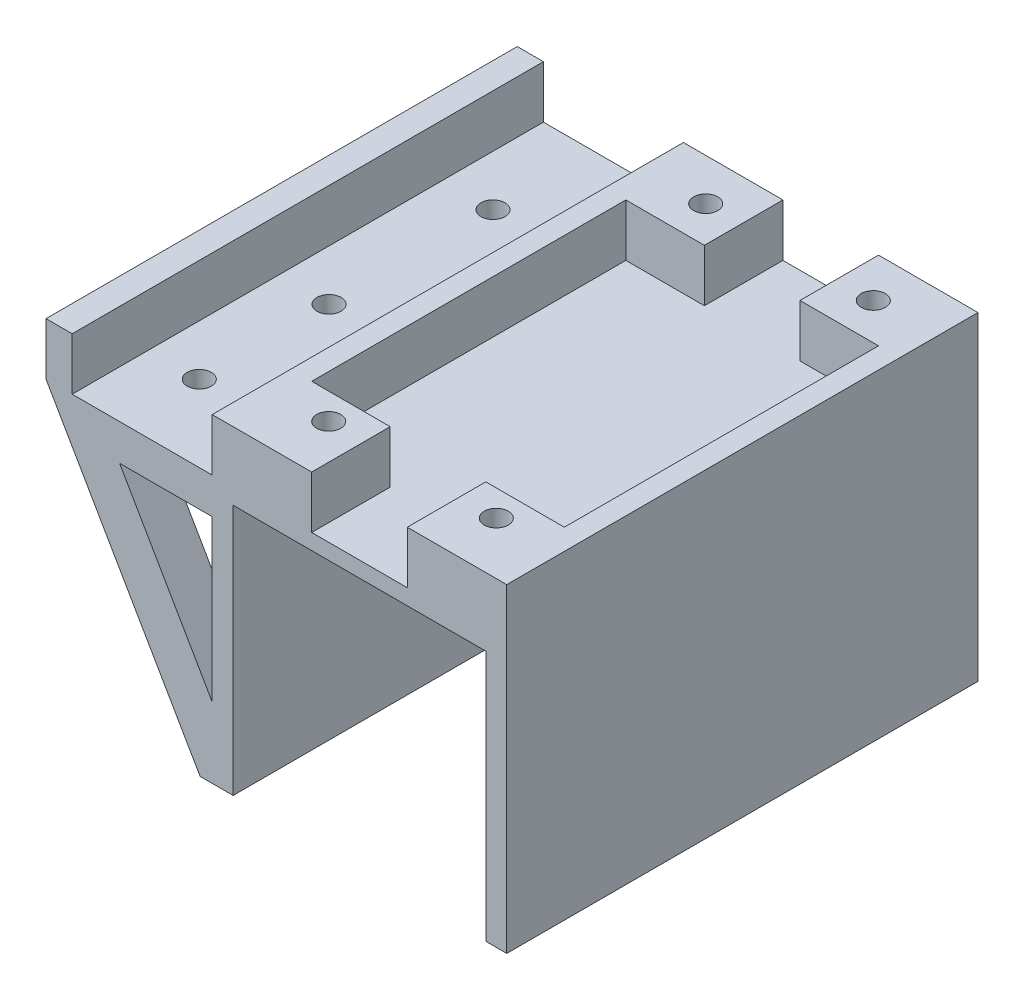
from build123d import *

# Parameters (mm, degrees)
SKETCH1_W            = 48.254
SKETCH1_H            = 10
BOSS_EXTRUDE1_DEPTH  = 70
BOSS_EXTRUDE3_DEPTH  = 8
BOSS_EXTRUDE4_DEPTH  = 8
BOSS_EXTRUDE5_DEPTH  = 8
BOSS_EXTRUDE6_DEPTH  = 70
SKETCH7_W            = 40.394634483
SKETCH7_H            = 17
CUT_EXTRUDE3_DEPTH   = 70
BOSS_EXTRUDE7_DEPTH  = 70
BOSS_EXTRUDE10_DEPTH = 8
BOSS_EXTRUDE11_DEPTH = 70
SKETCH13_W           = 83.001411072
SKETCH13_H           = 87.868559997
CUT_EXTRUDE4_DEPTH   = 4
SKETCH14_W           = 48.254
SKETCH14_H           = 10
BOSS_EXTRUDE12_DEPTH = 20
SKETCH16_W           = 56.254
SKETCH16_H           = 5
CUT_EXTRUDE5_DEPTH   = 100
SKETCH17_W           = 15
SKETCH17_H           = 15
BOSS_EXTRUDE14_DEPTH = 13
CUT_EXTRUDE8_DEPTH   = 5
SKETCH21_R           = 2.3
CUT_EXTRUDE9_DEPTH   = 15
SKETCH23_W           = 12
SKETCH23_H           = 40.530858039
CUT_EXTRUDE10_DEPTH  = 9
SKETCH25_R           = 2.3
CUT_EXTRUDE11_DEPTH  = 20
SKETCH26_R           = 2.3
CUT_EXTRUDE12_DEPTH  = 20
BOSS_EXTRUDE16_DEPTH = 20
SKETCH28_W           = 15
SKETCH28_H           = 15
BOSS_EXTRUDE17_DEPTH = 10
SKETCH29_R           = 2.3
CUT_EXTRUDE13_DEPTH  = 20
SKETCH30_W           = 10.391026801
SKETCH30_H           = 12
BOSS_EXTRUDE18_DEPTH = 5
SKETCH31_R           = 2.3
CUT_EXTRUDE14_DEPTH  = 45
SKETCH41_W           = 5
SKETCH41_H           = 90
BOSS_EXTRUDE19_DEPTH = 10


with BuildPart() as part:
    # Sketch1 → Boss-Extrude1 (new body)
    with BuildSketch(Plane.XY):
        Polygon((0, 70), (0, 0), (4, 0), (4, 52), (52.254, 52), (52.254, 0), (56.254, 0), (56.254, 70), align=None)
        with Locations((28.127, 60)):
            Rectangle(SKETCH1_W, SKETCH1_H, mode=Mode.SUBTRACT)
    extrude(amount=BOSS_EXTRUDE1_DEPTH)

    # Sketch3 → Boss-Extrude3 (add)
    with BuildSketch(Plane.XY.offset(70)):
        Polygon((0, 62.5), (0, 70), (-40.394634483, 70), (0, 0.034440722), (0, 17.466679003), (-26, 62.5), align=None)
    extrude(amount=-BOSS_EXTRUDE3_DEPTH)

    # Sketch4 → Boss-Extrude4 (add)
    with BuildSketch(Plane(origin=(0, 0, 0), x_dir=(-1, 0, 0), z_dir=(0, 0, -1))):
        Polygon((0, 70), (40.394634483, 70), (0, 0), (0, 17.466679003), (26, 62.5), (0, 62.5), align=None)
    extrude(amount=-BOSS_EXTRUDE4_DEPTH)

    # Sketch5 → Boss-Extrude5 (add)
    with BuildSketch(Plane(origin=(0, 0, 39), x_dir=(-1, 0, 0), z_dir=(0, 0, -1))):
        Polygon((0, 62.5), (0, 70), (40.394634483, 70), (0, 0), (0, 17.466679003), (26, 62.5), align=None)
    extrude(amount=BOSS_EXTRUDE5_DEPTH)

    # Sketch6 → Boss-Extrude6 (add)
    with BuildSketch(Plane(origin=(0, 0, 0), x_dir=(-1, 0, 0), z_dir=(0, 0, -1))):
        Polygon((0, 62.5), (36.066637932, 62.5), (40.394634483, 70), (0, 70), align=None)
        Polygon((-4, 0), (0, 0), (7.50186069, 13), (-4, 13), align=None)
    extrude(amount=-BOSS_EXTRUDE6_DEPTH)

    # Sketch7 → Cut-Extrude3 (cut)
    with BuildSketch(Plane.XY.offset(70)):
        with Locations((-20.197317242, 61.5)):
            Rectangle(SKETCH7_W, SKETCH7_H)
    extrude(amount=-CUT_EXTRUDE3_DEPTH, mode=Mode.SUBTRACT)

    # Sketch8 → Boss-Extrude7 (add)
    with BuildSketch(Plane(origin=(0, 0, 0), x_dir=(-1, 0, 0), z_dir=(0, 0, -1))):
        Polygon((-4, 55), (-4, 52), (30.007442759, 52), (31.73864138, 55), align=None)
    extrude(amount=-BOSS_EXTRUDE7_DEPTH)

    # Sketch11 → Boss-Extrude10 (add)
    with BuildSketch(Plane.XY.offset(70)):
        Polygon((-31.73864138, 55), (0, 0), (-3.053687451, 13), (-27.288965695, 55), align=None)
    extrude(amount=-BOSS_EXTRUDE10_DEPTH)

    # Sketch12 → Boss-Extrude11 (add)
    with BuildSketch(Plane.XY.offset(70)):
        Polygon((-31.73864138, 55), (-27.75981023, 48.105069917), (0, 48.105069917), (0, 55), align=None)
    extrude(amount=-BOSS_EXTRUDE11_DEPTH)

    # Sketch13 → Cut-Extrude4 (cut)
    with BuildSketch(Plane.XZ):
        with Locations((25.938658228, 33.313825886)):
            Rectangle(SKETCH13_W, SKETCH13_H)
    extrude(amount=-CUT_EXTRUDE4_DEPTH, mode=Mode.SUBTRACT)

    # Sketch14 → Boss-Extrude12 (add)
    with BuildSketch(Plane.XY.offset(70)):
        Polygon((-2.308264828, 4), (-31.73864138, 55), (0, 55), (0, 70), (56.254, 70), (56.254, 4), (52.254, 4), (52.254, 52), (4, 52), (4, 4), align=None)
        Polygon((-17.689083241, 48.105069917), (0, 48.105069917), (0, 17.466679003), align=None, mode=Mode.SUBTRACT)
        with Locations((28.127, 60)):
            Rectangle(SKETCH14_W, SKETCH14_H, mode=Mode.SUBTRACT)
    extrude(amount=BOSS_EXTRUDE12_DEPTH)

    # Sketch16 → Cut-Extrude5 (cut)
    with BuildSketch(Plane.XY.offset(90)):
        with Locations((28.127, 67.5)):
            Rectangle(SKETCH16_W, SKETCH16_H)
    extrude(amount=-CUT_EXTRUDE5_DEPTH, mode=Mode.SUBTRACT)

    # Sketch17 → Boss-Extrude14 (add)
    with BuildSketch(Plane(origin=(0, 65, 0), x_dir=(1, 0, 0), z_dir=(0, 1, 0))):
        with Locations((44.754, -7.5)):
            Rectangle(SKETCH17_W, SKETCH17_H)
        with Locations((44.754, -82.5)):
            Rectangle(SKETCH17_W, SKETCH17_H)
    extrude(amount=-BOSS_EXTRUDE14_DEPTH)

    # Sketch22 → Cut-Extrude8 (cut)
    with BuildSketch(Plane.XZ.offset(-52)):
        Polygon((48.096455918, 6.003620146), (47.904143628, 10.329474511), (44.06168771, 12.325854365), (40.411544082, 9.996379854), (40.603856372, 5.670525489), (44.44631229, 3.674145635), align=None)
        Polygon((45.200685086, 75.774625774), (48.386623963, 78.707166221), (47.439938877, 82.932540447), (43.307314914, 84.225374226), (40.121376037, 81.292833779), (41.068061123, 77.067459553), align=None)
    extrude(amount=-CUT_EXTRUDE8_DEPTH, mode=Mode.SUBTRACT)

    # Sketch21 → Cut-Extrude9 (cut)
    with BuildSketch(Plane(origin=(0, 52, 0), x_dir=(-1, 0, 0), z_dir=(0, -1, 0))):
        with Locations((-44.254, -80)):
            Circle(SKETCH21_R)
        with Locations((-44.254, -8)):
            Circle(SKETCH21_R)
    extrude(amount=-CUT_EXTRUDE9_DEPTH, mode=Mode.SUBTRACT)

    # Sketch23 → Cut-Extrude10 (cut)
    with BuildSketch(Plane(origin=(0, 0, 0), x_dir=(0, 0, 1), z_dir=(-0.8661319205837115, -0.49981546209173167, 0))):
        with Locations((76, 35.274689955)):
            Rectangle(SKETCH23_W, SKETCH23_H)
    extrude(amount=-CUT_EXTRUDE10_DEPTH, mode=Mode.SUBTRACT)

    # Sketch25 → Cut-Extrude11 (cut)
    with BuildSketch(Plane(origin=(0, 48.105069917, 0), x_dir=(-1, 0, 0), z_dir=(0, -1, 0))):
        with Locations((17.075514089, -19.30064897)):
            Circle(SKETCH25_R)
        with Locations((17.075514089, -50.613733273)):
            Circle(SKETCH25_R)
    extrude(amount=-CUT_EXTRUDE11_DEPTH, mode=Mode.SUBTRACT)

    # Sketch26 → Cut-Extrude12 (cut)
    with BuildSketch(Plane.XZ.offset(-48.105069917)):
        with Locations((-17.075514089, 75.391336138)):
            Circle(SKETCH26_R)
    extrude(amount=-CUT_EXTRUDE12_DEPTH, mode=Mode.SUBTRACT)

    # Sketch27 → Boss-Extrude16 (add)
    with BuildSketch(Plane.XY.offset(90)):
        Polygon((-23.310381194, 48.105069917), (-27.75981023, 48.105069917), (-31.73864138, 55), (-23.310381194, 55), align=None)
    extrude(amount=-BOSS_EXTRUDE16_DEPTH)

    # Sketch28 → Boss-Extrude17 (add)
    with BuildSketch(Plane(origin=(0, 55, 0), x_dir=(1, 0, 0), z_dir=(0, 1, 0))):
        with Locations((11.5, -7.5)):
            Rectangle(SKETCH28_W, SKETCH28_H)
        with Locations((11.5, -82.5)):
            Rectangle(SKETCH28_W, SKETCH28_H)
    extrude(amount=BOSS_EXTRUDE17_DEPTH)

    # Sketch29 → Cut-Extrude13 (cut)
    with BuildSketch(Plane(origin=(0, 52, 0), x_dir=(-1, 0, 0), z_dir=(0, -1, 0))):
        with Locations((-12.254, -8)):
            Circle(SKETCH29_R)
        with Locations((-12.254, -80)):
            Circle(SKETCH29_R)
    extrude(amount=-CUT_EXTRUDE13_DEPTH, mode=Mode.SUBTRACT)

    # Sketch30 → Boss-Extrude18 (add)
    with BuildSketch(Plane.XZ.offset(-48.105069917)):
        with Locations((-22.56429683, 76)):
            Rectangle(SKETCH30_W, SKETCH30_H)
    extrude(amount=-BOSS_EXTRUDE18_DEPTH)

    # Sketch31 → Cut-Extrude14 (cut)
    with BuildSketch(Plane.XZ.offset(-48.105069917)):
        with Locations((-17.075514089, 75.391336138)):
            Circle(SKETCH31_R)
    extrude(amount=-CUT_EXTRUDE14_DEPTH, mode=Mode.SUBTRACT)

    # Sketch41 → Boss-Extrude19 (add)
    with BuildSketch(Plane(origin=(0, 55, 0), x_dir=(1, 0, 0), z_dir=(0, 1, 0))):
        with Locations((-29.23864138, -45)):
            Rectangle(SKETCH41_W, SKETCH41_H)
    extrude(amount=BOSS_EXTRUDE19_DEPTH)


solid = part.part
